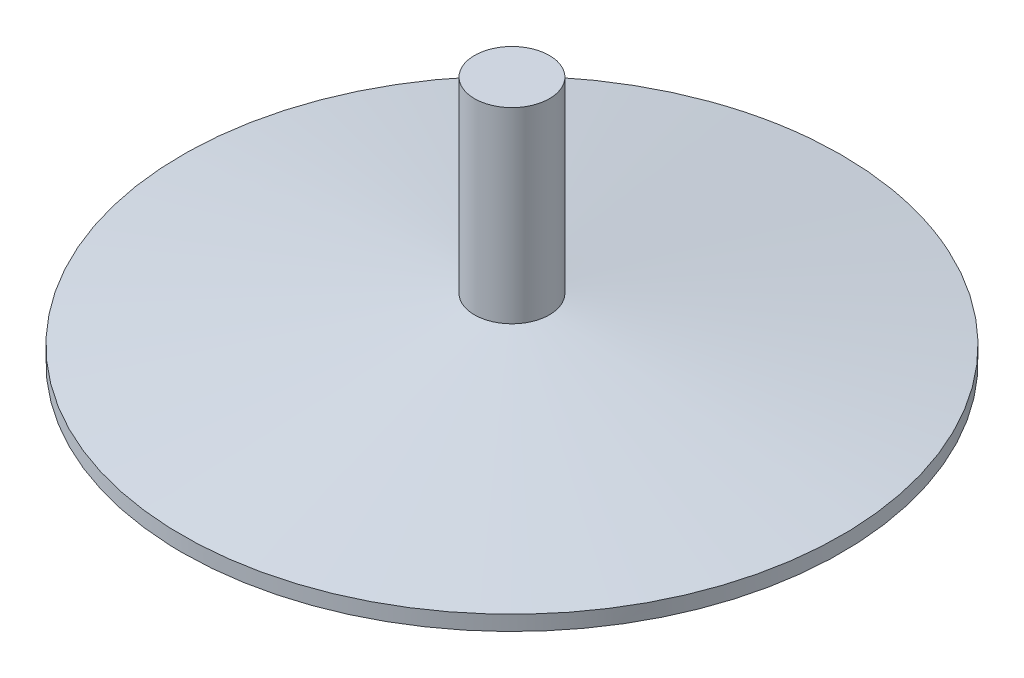
from build123d import *

# Parameters (mm, degrees)
SKETCH1_R           = 4400
BOSS_EXTRUDE1_DEPTH = 200
SKETCH3_R           = 500
BOSS_EXTRUDE2_DEPTH = 2500


with BuildPart() as part:
    # Sketch1 → Boss-Extrude1 (new body)
    with BuildSketch(Plane(origin=(0, 0, 0), x_dir=(1, 0, 0), z_dir=(0, 1, 0))):
        with Locations(Location((0, 0, 0), (0, 0, 270))):
            Circle(SKETCH1_R)
    extrude(amount=BOSS_EXTRUDE1_DEPTH)

    # Loft1: read off the stored shape, not the designer's step
    # Loft1: loft between two sections, ruled curve by curve
    loft1_from = [
        Edge.make_bspline([(-171.361945774, 200, 4396.661811368), (8621.961676961, 200, 4739.385702916), (8964.68556851, 200, -4053.937919819), (171.361945774, 200, -4396.661811368), (-8621.961676961, 200, -4739.385702916), (-8964.68556851, 200, 4053.937919819), (-171.361945774, 200, 4396.661811368)], [0, 0, 0, 0, 0.5, 0.5, 0.5, 1, 1, 1, 1], 3, [1, 0.333333333, 0.333333333, 1, 0.333333333, 0.333333333, 1]),
    ]
    loft1_to = [
        Edge.make_bspline([(143.713693887, 800, 478.901215481), (1101.516124849, 800, 191.473827707), (814.088737075, 800, -766.328603255), (-143.713693887, 800, -478.901215481), (-1101.516124849, 800, -191.473827707), (-814.088737075, 800, 766.328603255), (143.713693887, 800, 478.901215481)], [0, 0, 0, 0, 0.5, 0.5, 0.5, 1, 1, 1, 1], 3, [1, 0.333333333, 0.333333333, 1, 0.333333333, 0.333333333, 1]),
    ]
    loft1 = Solid(Shell([*[Face.make_surface_from_curves(loft1_from[k], loft1_to[k]) for k in range(1)], Face(Wire(loft1_from)), Face(Wire(loft1_to))]))
    add(loft1)

    # Sketch3 → Boss-Extrude2 (add)
    with BuildSketch(Plane(origin=(0, 800, 0), x_dir=(1, 0, 0), z_dir=(0, 1, 0))):
        with Locations(Location((0, 0, 0), (0, 0, 286.704))):
            Circle(SKETCH3_R)
    extrude(amount=BOSS_EXTRUDE2_DEPTH)


solid = part.part
